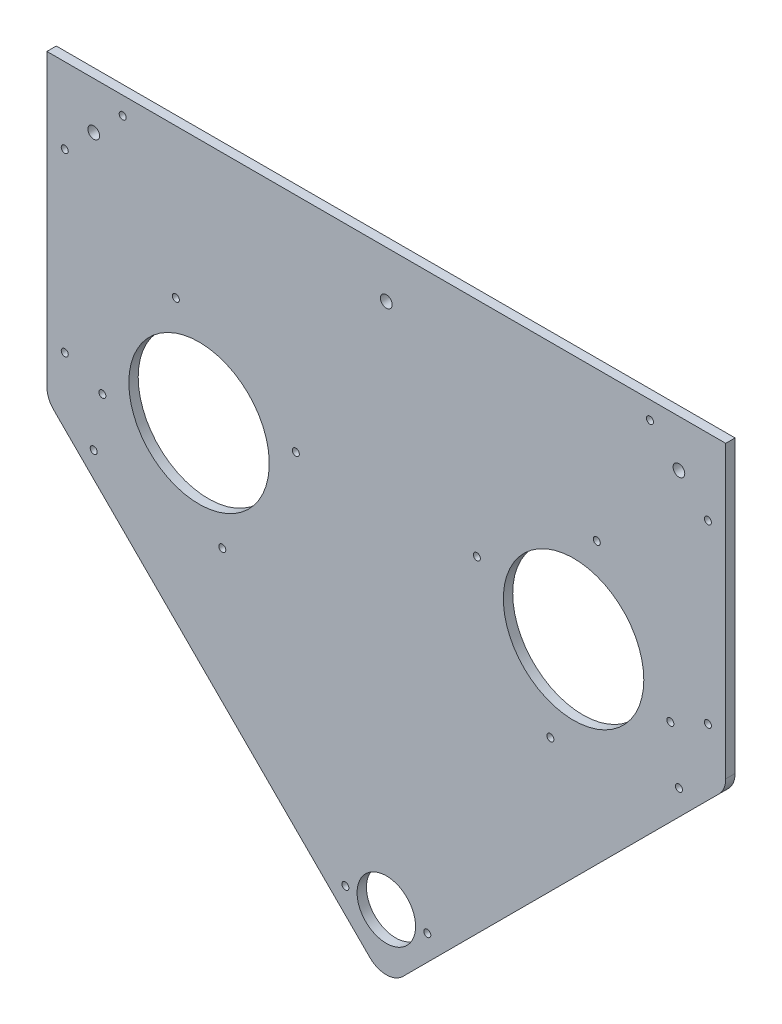
from build123d import *

# Parameters (mm, degrees)
SKETCH1_R           = 12.5
SKETCH1_R_2         = 1.5
SKETCH1_R_3         = 2.5
BOSS_EXTRUDE1_DEPTH = 4
FILLET1_R           = 10
SKETCH2_R           = 1.5
SKETCH2_R_2         = 30
CUT_EXTRUDE1_DEPTH  = 10


with BuildPart() as part:
    # Sketch1 → Boss-Extrude1 (new body)
    with BuildSketch(Plane.XY):
        Polygon((-145, 120), (145, 120), (145, -8.284271247), (0, -153.284271247), (-145, -8.284271247), align=None)
        with Locations((0, -125)):
            Circle(SKETCH1_R, mode=Mode.SUBTRACT)
        with Locations((-137.374368671, 87.625631329)):
            Circle(SKETCH1_R_2, mode=Mode.SUBTRACT)
        with Locations((-112.625631329, 112.374368671)):
            Circle(SKETCH1_R_2, mode=Mode.SUBTRACT)
        with Locations((-137.374368671, 12.374368671)):
            Circle(SKETCH1_R_2, mode=Mode.SUBTRACT)
        with Locations((-125, -17.5)):
            Circle(SKETCH1_R_2, mode=Mode.SUBTRACT)
        with Locations((-17.5, -125)):
            Circle(SKETCH1_R_2, mode=Mode.SUBTRACT)
        with Locations((17.5, -125)):
            Circle(SKETCH1_R_2, mode=Mode.SUBTRACT)
        with Locations((125, -17.5)):
            Circle(SKETCH1_R_2, mode=Mode.SUBTRACT)
        with Locations((137.374368671, 12.374368671)):
            Circle(SKETCH1_R_2, mode=Mode.SUBTRACT)
        with Locations((137.374368671, 87.625631329)):
            Circle(SKETCH1_R_2, mode=Mode.SUBTRACT)
        with Locations((112.625631329, 112.374368671)):
            Circle(SKETCH1_R_2, mode=Mode.SUBTRACT)
        with Locations((0, 100)):
            Circle(SKETCH1_R_3, mode=Mode.SUBTRACT)
        with Locations((-125, 100)):
            Circle(SKETCH1_R_3, mode=Mode.SUBTRACT)
        with Locations((125, 100)):
            Circle(SKETCH1_R_3, mode=Mode.SUBTRACT)
    extrude(amount=BOSS_EXTRUDE1_DEPTH)

    # Fillet1
    fillet1_edges = [part.edges().sort_by_distance(p)[0] for p in [
        (-145, -8.284271247, 2),
        (145, -8.284271247, 2),
        (0, -153.284271247, 2),
    ]]
    fillet(fillet1_edges, radius=FILLET1_R)

    # Sketch2 → Cut-Extrude1 (cut)
    with BuildSketch(Plane.XY.offset(4)):
        with Locations((38.67402397, 24.920368197)):
            Circle(SKETCH2_R)
        with Locations((89.920368197, 56.32597603)):
            Circle(SKETCH2_R)
        with Locations((121.32597603, 5.079631803)):
            Circle(SKETCH2_R)
        with Locations((70.079631803, -26.32597603)):
            Circle(SKETCH2_R)
        with Locations((80, 15)):
            Circle(SKETCH2_R_2)
        with Locations((-38.67402397, 24.920368197)):
            Circle(SKETCH2_R)
        with Locations((-89.920368197, 56.32597603)):
            Circle(SKETCH2_R)
        with Locations((-70.079631803, -26.32597603)):
            Circle(SKETCH2_R)
        with Locations((-121.32597603, 5.079631803)):
            Circle(SKETCH2_R)
        with Locations((-80, 15)):
            Circle(SKETCH2_R_2)
    extrude(amount=-CUT_EXTRUDE1_DEPTH, mode=Mode.SUBTRACT)


solid = part.part
